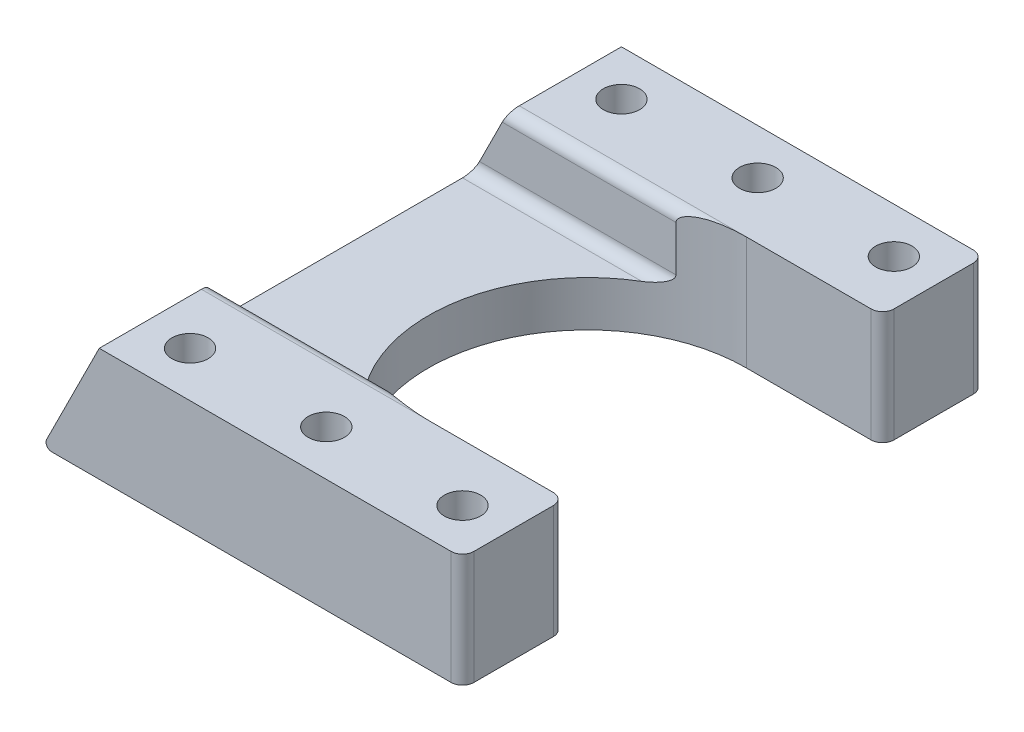
from build123d import *

# Parameters (mm, degrees)
SKETCH2_R           = 1.6
BOSS_EXTRUDE1_DEPTH = 10
BOSS_EXTRUDE2_DEPTH = 46
CUT_EXTRUDE1_START  = -6
SKETCH5_W           = 5
SKETCH5_H           = 13
CUT_EXTRUDE1_DEPTH  = 6
FILLET1_R           = 1
FILLET2_R           = 0.5
FILLET3_R           = 1


with BuildPart() as part:
    # Sketch2 → Boss-Extrude1 (new body)
    with BuildSketch(Plane(origin=(0, 0, 0), x_dir=(1, 0, 0), z_dir=(0, 1, 0))):
        with BuildLine():
            ThreePointArc((-10, 0), (-7.22497216, 8.366600265), (0, 13.416407865))
            ThreePointArc((0, 13.416407865), (1.97882585, 13.853333716), (4, 14))
            Line((4, 14), (16, 14))
            Line((16, 14), (16, 23))
            Line((16, 23), (-16, 23))
            Line((-16, 23), (-16, -23))
            Line((-16, -23), (16, -23))
            Line((16, -23), (16, -14))
            Line((16, -14), (4, -14))
            ThreePointArc((4, -14), (-5.899494937, -9.899494937), (-10, 0))
        make_face()
        with Locations(Location((-12, -19, 0), (0, 0, 270))):
            Circle(SKETCH2_R, mode=Mode.SUBTRACT)
        with Locations(Location((0, -19, 0), (0, 0, 270))):
            Circle(SKETCH2_R, mode=Mode.SUBTRACT)
        with Locations(Location((12, -19, 0), (0, 0, 270))):
            Circle(SKETCH2_R, mode=Mode.SUBTRACT)
        with BuildLine():
            ThreePointArc((-10.4, 19), (-10.86862915, 17.86862915), (-12, 17.4))
            ThreePointArc((-12, 17.4), (-13.13137085, 20.13137085), (-10.4, 19))
        make_face(mode=Mode.SUBTRACT)
        with BuildLine():
            ThreePointArc((1.6, 19), (1.13137085, 17.86862915), (0, 17.4))
            ThreePointArc((0, 17.4), (-1.13137085, 20.13137085), (1.6, 19))
        make_face(mode=Mode.SUBTRACT)
        with Locations(Location((12, 19, 0), (0, 0, 270))):
            Circle(SKETCH2_R, mode=Mode.SUBTRACT)
    extrude(amount=BOSS_EXTRUDE1_DEPTH)

    # Sketch4 → Boss-Extrude2 (add)
    with BuildSketch(Plane.XY.offset(23)):
        Polygon((-21, 0), (-16, 10), (-16, 0), align=None)
    extrude(amount=-BOSS_EXTRUDE2_DEPTH)

    # Sketch5 → Cut-Extrude1 (cut)
    with BuildSketch(Plane(origin=(0, 10, 0), x_dir=(1, 0, 0), z_dir=(0, 1, 0)).offset(CUT_EXTRUDE1_START)):
        with BuildLine():
            Line((-16, 0), (-10, 0))
            ThreePointArc((-10, 0), (-7.591939741, 7.850282354), (-1.196152423, 13))
            Line((-1.196152423, 13), (-16, 13))
            Line((-16, 13), (-16, 0))
        make_face()
        with Locations((-18.5, 6.5)):
            Rectangle(SKETCH5_W, SKETCH5_H)
        with BuildLine():
            ThreePointArc((-1.196152423, -13), (-7.591939741, -7.850282354), (-10, 0))
            Line((-10, 0), (-16, 0))
            Line((-16, 0), (-16, -13))
            Line((-16, -13), (-1.196152423, -13))
        make_face()
        with Locations((-18.5, -6.5)):
            Rectangle(SKETCH5_W, SKETCH5_H)
    extrude(amount=CUT_EXTRUDE1_DEPTH, mode=Mode.SUBTRACT)

    # Fillet1
    fillet1_edges = [part.edges().sort_by_distance(p)[0] for p in [
        (-8.598076211, 10, 13),
        (-10.098076211, 4, 13),
        (-10.098076211, 4, -13),
        (-8.598076211, 10, -13),
    ]]
    fillet(fillet1_edges, radius=FILLET1_R - 0.0001)  # a hair under: the kernel refuses the full size

    # Fillet2
    fillet2_edges = [part.edges().sort_by_distance(p)[0] for p in [
        (-21, 0, 0),
    ]]
    fillet(fillet2_edges, radius=FILLET2_R)

    # Fillet3
    fillet3_edges = [part.edges().sort_by_distance(p)[0] for p in [
        (16, 5, 14),
        (16, 5, 23),
        (16, 5, -23),
        (16, 5, -14),
    ]]
    fillet(fillet3_edges, radius=FILLET3_R)


solid = part.part
